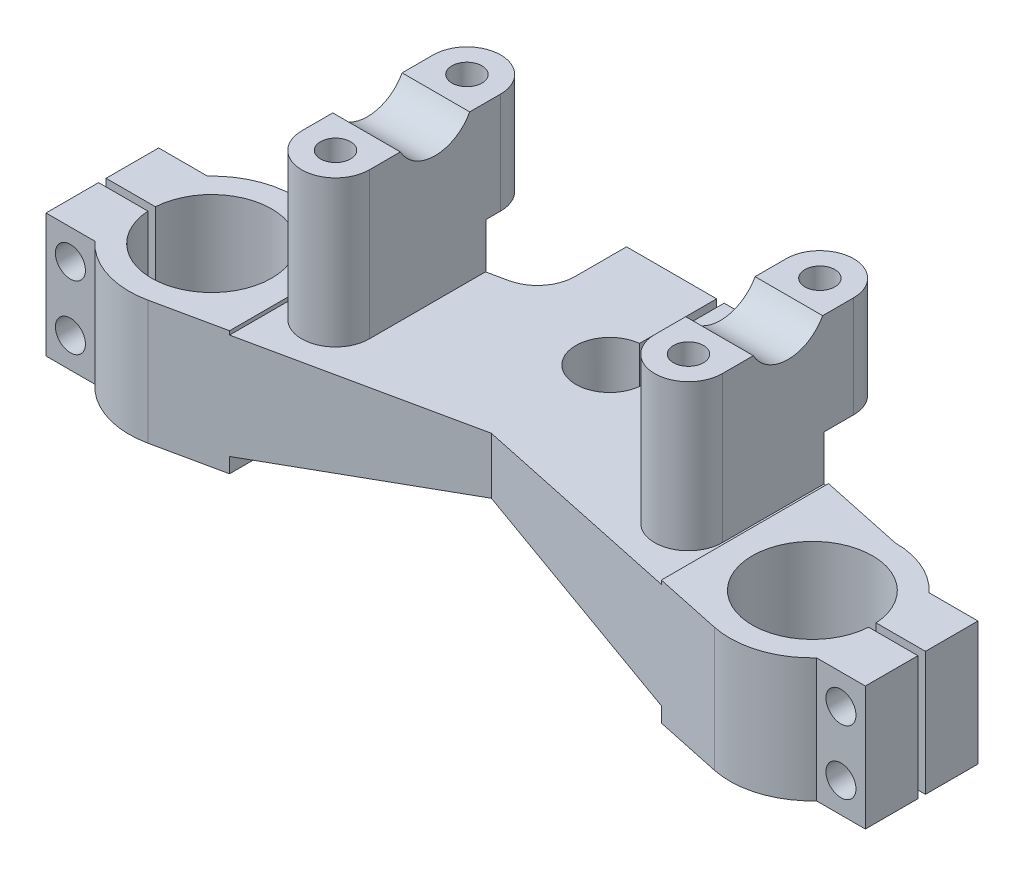
from build123d import *

# Parameters (mm, degrees)
BOSS_EXTRUDE1_DEPTH     = 33
FILLET2_R               = 10
FILLET3_R               = 10
CUT_EXTRUDE1_DEPTH      = 127.78010009
CUT_EXTRUDE1_DEPTH_BACK = 127.78010009
SKETCH3_W               = 115
SKETCH3_H               = 4.910725557
BOSS_EXTRUDE3_DEPTH     = 39
CUT_EXTRUDE5_DEPTH      = 65.5
CUT_EXTRUDE6_DEPTH      = 44
SKETCH9_R               = 4
CUT_EXTRUDE7_DEPTH      = 44
SKETCH10_R              = 4
CUT_EXTRUDE8_DEPTH      = 22
SKETCH11_R              = 4
CUT_EXTRUDE9_DEPTH      = 31
SKETCH12_R              = 10.5
CUT_EXTRUDE10_DEPTH     = 106.5


with BuildPart() as part:
    # Sketch1 → Boss-Extrude1 (new body)
    with BuildSketch(Plane(origin=(0, 0, 0), x_dir=(1, 0, 0), z_dir=(0, 1, 0))):
        with BuildLine():
            Line((-25, 55.5), (-25, 33.696074146))
            Line((-25, 33.696074146), (-80, 22.008574146))
            ThreePointArc((-80, 22.008574146), (-88.782047704, 20.180509757), (-96.105195929, 15))
            Line((-96.105195929, 15), (-109.105195929, 15))
            Line((-109.105195929, 15), (-109.105195929, 1))
            Line((-109.105195929, 1), (-95.968719423, 1))
            ThreePointArc((-95.968719423, 1), (-64, 0), (-95.968719423, -1))
            Line((-95.968719423, -1), (-109.105195929, -1))
            Line((-109.105195929, -1), (-109.105195929, -15))
            Line((-109.105195929, -15), (-96.105195929, -15))
            ThreePointArc((-96.105195929, -15), (-86.625068957, -20.987753506), (-75.425325161, -21.527881597))
            Line((-75.425325161, -21.527881597), (0, -5.5))
            Line((0, -5.5), (75.425325161, -21.527881597))
            ThreePointArc((75.425325161, -21.527881597), (86.625068957, -20.987753506), (96.105195929, -15))
            Line((96.105195929, -15), (109.105195929, -15))
            Line((109.105195929, -15), (109.105195929, -1))
            Line((109.105195929, -1), (95.968719423, -1))
            ThreePointArc((95.968719423, -1), (64, 0), (95.968719423, 1))
            Line((95.968719423, 1), (109.105195929, 1))
            Line((109.105195929, 1), (109.105195929, 15))
            Line((109.105195929, 15), (96.105195929, 15))
            ThreePointArc((96.105195929, 15), (88.782047704, 20.180509757), (80, 22.008574146))
            Line((80, 22.008574146), (25, 33.696074146))
            Line((25, 33.696074146), (25, 55.5))
            Line((25, 55.5), (1, 55.5))
            Line((1, 55.5), (1, 34.94427191))
            ThreePointArc((1, 34.94427191), (0, 17), (-1, 34.94427191))
            Line((-1, 34.94427191), (-1, 55.5))
            Line((-1, 55.5), (-25, 55.5))
        make_face()
    extrude(amount=BOSS_EXTRUDE1_DEPTH)

    # Fillet2
    fillet2_edges = [part.edges().sort_by_distance(p)[0] for p in [
        (25, 16.5, -33.696074146),
    ]]
    fillet(fillet2_edges, radius=FILLET2_R)

    # Fillet3
    fillet3_edges = [part.edges().sort_by_distance(p)[0] for p in [
        (-25, 16.5, -33.696074146),
    ]]
    fillet(fillet3_edges, radius=FILLET3_R)

    # Sketch3 → Cut-Extrude1 (cut, two sides: drawn at the far end of the back side and taken through both)
    with BuildSketch(Plane.XY.offset(-CUT_EXTRUDE1_DEPTH_BACK)):
        with Locations((0, 34.455362779)):
            Rectangle(SKETCH3_W, SKETCH3_H)
        Polygon((-57.5, 4), (-57.5, -3.298292375), (57.5, -3.298292375), (57.5, 4), (0, 17), align=None)
    extrude(amount=CUT_EXTRUDE1_DEPTH + CUT_EXTRUDE1_DEPTH_BACK, mode=Mode.SUBTRACT)

    # Sketch5 → Boss-Extrude3 (add)
    with BuildSketch(Plane(origin=(0, 71, 0), x_dir=(1, 0, 0), z_dir=(0, 1, 0))):
        with BuildLine():
            Line((-38, 0), (-38, 35))
            ThreePointArc((-38, 35), (-47, 44), (-56, 35))
            Line((-56, 35), (-56, 0))
            ThreePointArc((-56, 0), (-47, -9), (-38, 0))
        make_face()
        with BuildLine():
            Line((56, 0), (56, 35))
            ThreePointArc((56, 35), (47, 44), (38, 35))
            Line((38, 35), (38, 0))
            ThreePointArc((38, 0), (47, -9), (56, 0))
        make_face()
    extrude(amount=-BOSS_EXTRUDE3_DEPTH)

    # Sketch6 → Cut-Extrude5 (cut, symmetric)
    with BuildSketch(Plane(origin=(0, 0, 0), x_dir=(0, 0, -1), z_dir=(1, 0, 0))):
        Polygon((44, 71), (44, 44), (31.054287073, 44), (31.054287073, 32), (44, 32), (62.918124126, 32), (62.918124126, 71), align=None)
    extrude(amount=CUT_EXTRUDE5_DEPTH, both=True, mode=Mode.SUBTRACT)

    # Sketch7 → Cut-Extrude6 (cut)
    with BuildSketch(Plane(origin=(0, 0, 0), x_dir=(1, 0, 0), z_dir=(0, 1, 0))):
        Polygon((-56, 31.054287073), (-38, 31.054287073), (-56, 27.108574146), align=None)
        Polygon((56, 27.108574146), (56, 31.054287073), (38, 31.054287073), align=None)
    extrude(amount=CUT_EXTRUDE6_DEPTH, mode=Mode.SUBTRACT)

    # Sketch9 → Cut-Extrude7 (cut)
    with BuildSketch(Plane(origin=(0, 71, 0), x_dir=(1, 0, 0), z_dir=(0, 1, 0))):
        with Locations((-47, 0)):
            Circle(SKETCH9_R)
        with Locations((-47, 35)):
            Circle(SKETCH9_R)
        with Locations((47, 0)):
            Circle(SKETCH9_R)
        with Locations((47, 35)):
            Circle(SKETCH9_R)
    extrude(amount=-CUT_EXTRUDE7_DEPTH, mode=Mode.SUBTRACT)

    # Sketch10 → Cut-Extrude8 (cut, symmetric)
    with BuildSketch(Plane.XY):
        with Locations((-102.605195929, 8)):
            Circle(SKETCH10_R)
        with Locations((-102.605195929, 25)):
            Circle(SKETCH10_R)
        with Locations((102.605195929, 8)):
            Circle(SKETCH10_R)
        with Locations((102.605195929, 25)):
            Circle(SKETCH10_R)
    extrude(amount=CUT_EXTRUDE8_DEPTH, both=True, mode=Mode.SUBTRACT)

    # Sketch11 → Cut-Extrude9 (cut, symmetric)
    with BuildSketch(Plane(origin=(0, 0, 0), x_dir=(0, 0, -1), z_dir=(1, 0, 0))):
        with Locations((48.647181255, 21.673913043)):
            Circle(SKETCH11_R)
    extrude(amount=CUT_EXTRUDE9_DEPTH, both=True, mode=Mode.SUBTRACT)

    # Sketch12 → Cut-Extrude10 (cut, symmetric)
    with BuildSketch(Plane(origin=(0, 0, 0), x_dir=(0, 0, -1), z_dir=(1, 0, 0))):
        with Locations((17.5, 76)):
            Circle(SKETCH12_R)
    extrude(amount=CUT_EXTRUDE10_DEPTH, both=True, mode=Mode.SUBTRACT)


solid = part.part
